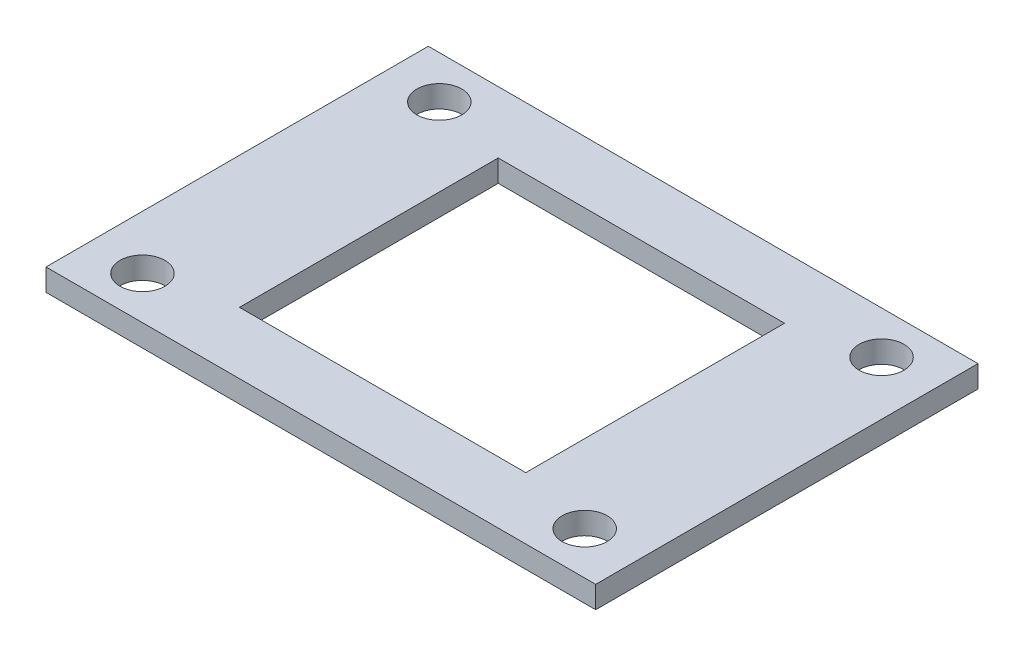
from build123d import *

# Parameters (mm, degrees)
SKETCH1_W           = 24.96
SKETCH1_H           = 17.36
BOSS_EXTRUDE1_DEPTH = 1
SKETCH2_W           = 13
SKETCH2_H           = 11.75
CUT_EXTRUDE1_DEPTH  = 31.41991453
SKETCH3_R           = 1.02
CUT_EXTRUDE2_DEPTH  = 31.41991453


with BuildPart() as part:
    # Sketch1 → Boss-Extrude1 (new body)
    with BuildSketch(Plane(origin=(0, 0, 0), x_dir=(1, 0, 0), z_dir=(0, 1, 0))):
        with Locations((12.48, -8.68)):
            Rectangle(SKETCH1_W, SKETCH1_H)
    extrude(amount=-BOSS_EXTRUDE1_DEPTH)

    # Sketch2 → Cut-Extrude1 (cut, through all)
    with BuildSketch(Plane(origin=(0, 0, 0), x_dir=(1, 0, 0), z_dir=(0, 1, 0))):
        with Locations((12.48, -8.68)):
            Rectangle(SKETCH2_W, SKETCH2_H)
    extrude(amount=-CUT_EXTRUDE1_DEPTH, mode=Mode.SUBTRACT)

    # Sketch3 → Cut-Extrude2 (cut, through all)
    with BuildSketch(Plane(origin=(0, 0, 0), x_dir=(1, 0, 0), z_dir=(0, 1, 0))):
        with Locations((2.44, -1.94)):
            Circle(SKETCH3_R)
        with Locations((22.52, -1.94)):
            Circle(SKETCH3_R)
        with Locations((22.52, -15.42)):
            Circle(SKETCH3_R)
        with Locations((2.44, -15.42)):
            Circle(SKETCH3_R)
    extrude(amount=-CUT_EXTRUDE2_DEPTH, mode=Mode.SUBTRACT)


solid = part.part
